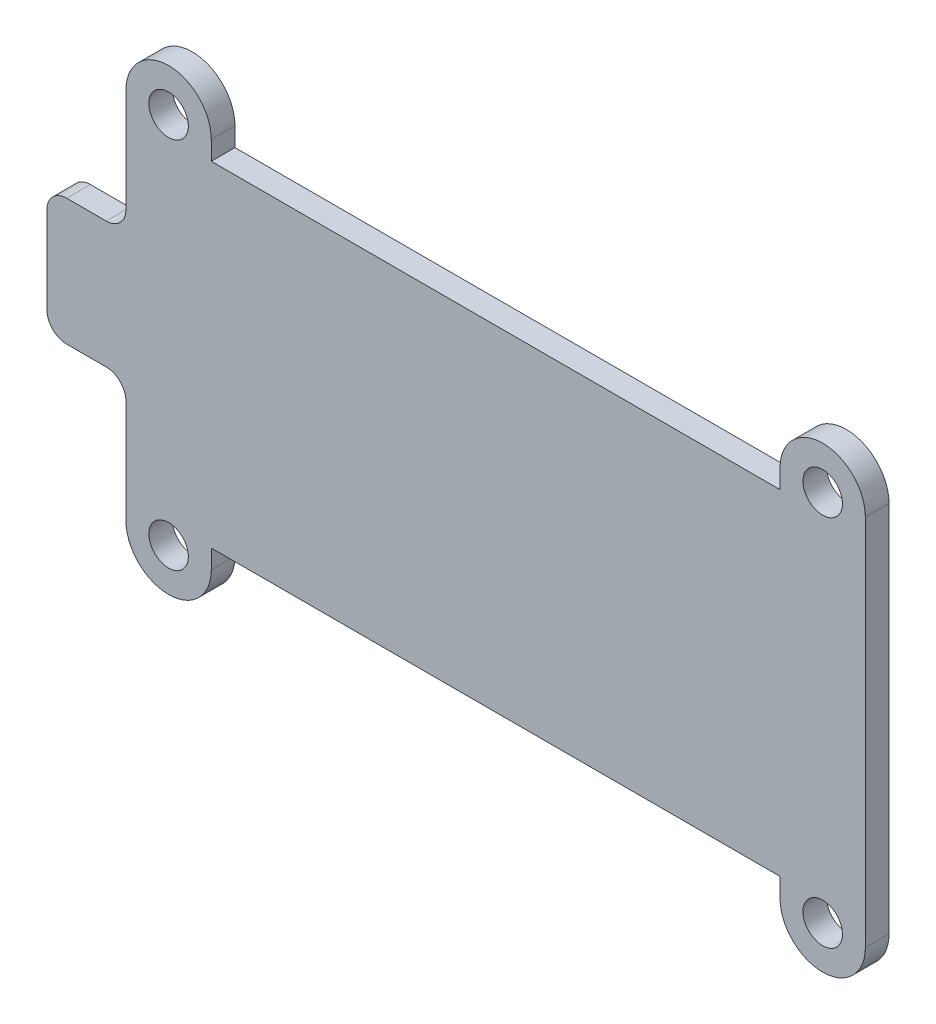
from build123d import *

# Parameters (mm, degrees)
SKETCH1_R           = 1.25
BOSS_EXTRUDE1_DEPTH = 1.5


with BuildPart() as part:
    # Sketch1 → Boss-Extrude1 (new body)
    with BuildSketch(Plane.XY):
        with BuildLine():
            Line((-24.65, 4), (-27.15, 4))
            ThreePointArc((-27.15, 4), (-28.033883476, 3.633883476), (-28.4, 2.75))
            Line((-28.4, 2.75), (-28.4, 2))
            Line((-28.4, 2), (-28.4, -2))
            Line((-28.4, -2), (-28.4, -2.75))
            ThreePointArc((-28.4, -2.75), (-28.033883476, -3.633883476), (-27.15, -4))
            Line((-27.15, -4), (-24.65, -4))
            ThreePointArc((-24.65, -4), (-23.766116524, -4.366116524), (-23.4, -5.25))
            Line((-23.4, -5.25), (-23.4, -11.8))
            ThreePointArc((-23.4, -11.8), (-20.7, -14.5), (-18, -11.8))
            Line((-18, -11.8), (-18, -10.6))
            Line((-18, -10.6), (18, -10.6))
            Line((18, -10.6), (18, -11.8))
            ThreePointArc((18, -11.8), (20.7, -14.5), (23.4, -11.8))
            Line((23.4, -11.8), (23.4, -3.8))
            Line((23.4, -3.8), (23.4, 3.8))
            Line((23.4, 3.8), (23.4, 11.8))
            ThreePointArc((23.4, 11.8), (20.7, 14.5), (18, 11.8))
            Line((18, 11.8), (18, 10.6))
            Line((18, 10.6), (-18, 10.6))
            Line((-18, 10.6), (-18, 11.8))
            ThreePointArc((-18, 11.8), (-20.7, 14.5), (-23.4, 11.8))
            Line((-23.4, 11.8), (-23.4, 5.25))
            ThreePointArc((-23.4, 5.25), (-23.766116524, 4.366116524), (-24.65, 4))
        make_face()
        with Locations((-20.7, 11.8)):
            Circle(SKETCH1_R, mode=Mode.SUBTRACT)
        with Locations((20.7, 11.8)):
            Circle(SKETCH1_R, mode=Mode.SUBTRACT)
        with Locations((20.7, -11.8)):
            Circle(SKETCH1_R, mode=Mode.SUBTRACT)
        with Locations((-20.7, -11.8)):
            Circle(SKETCH1_R, mode=Mode.SUBTRACT)
    extrude(amount=BOSS_EXTRUDE1_DEPTH)


solid = part.part
